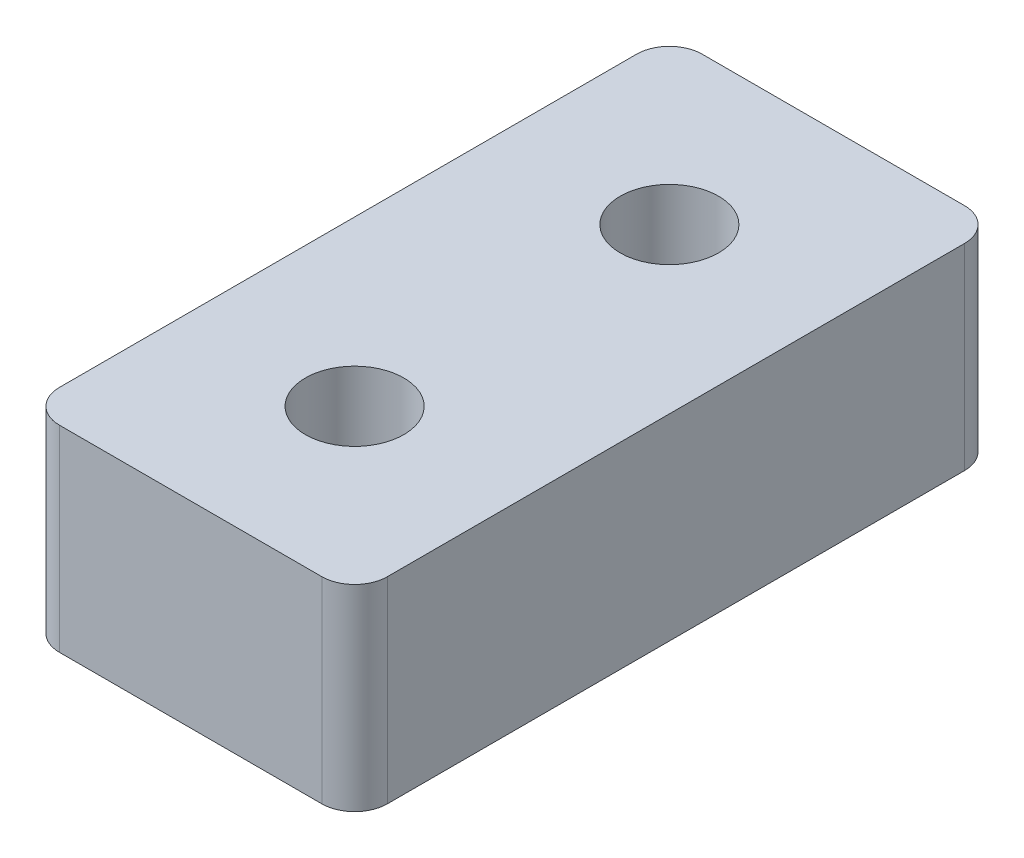
from build123d import *

# Parameters (mm, degrees)
SKETCH1_W           = 10
SKETCH1_H           = 19.6
SKETCH1_R           = 1.5
BOSS_EXTRUDE1_DEPTH = 6
FILLET1_R           = 1


with BuildPart() as part:
    # Sketch1 → Boss-Extrude1 (new body)
    with BuildSketch(Plane(origin=(0, 0, 0), x_dir=(1, 0, 0), z_dir=(0, 1, 0))):
        with Locations((5, 9.8)):
            Rectangle(SKETCH1_W, SKETCH1_H)
        with Locations((5, 14.6)):
            Circle(SKETCH1_R, mode=Mode.SUBTRACT)
        with Locations((5, 5)):
            Circle(SKETCH1_R, mode=Mode.SUBTRACT)
    extrude(amount=BOSS_EXTRUDE1_DEPTH)

    # Fillet1
    fillet1_edges = [part.edges().sort_by_distance(p)[0] for p in [
        (10, 3, -19.6),
        (10, 3, 0),
        (0, 3, 0),
        (0, 3, -19.6),
    ]]
    fillet(fillet1_edges, radius=FILLET1_R)


solid = part.part
